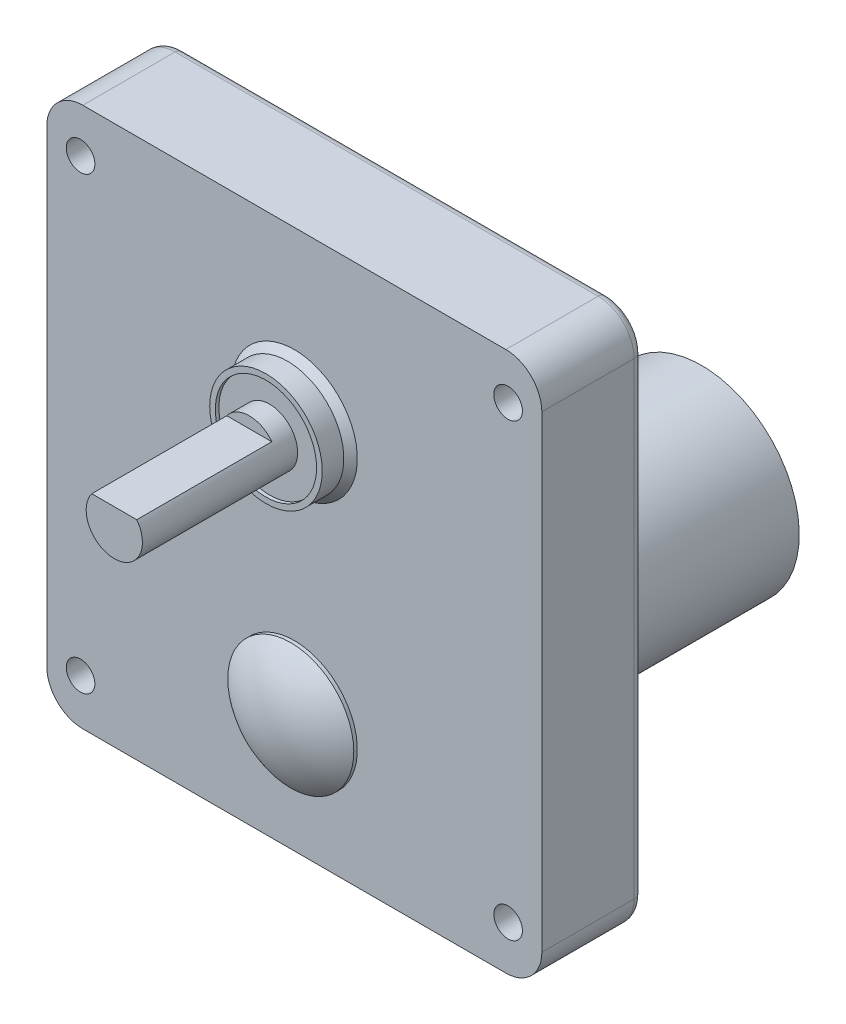
from build123d import *

# Parameters (mm, degrees)
CROQUIS1_W              = 69.85
CROQUIS1_H              = 76.2
EXTRUIR1_DEPTH          = 14.2875
CROQUIS2_R              = 7.9375
CROQUIS2_R_2            = 7.14375
EXTRUIR2_DEPTH          = 4
CROQUIS3_R              = 7.14375
CROQUIS3_R_2            = 3.96875
EXTRUIR3_DEPTH          = 3.5
CROQUIS4_R              = 3.96875
EXTRUIR4_DEPTH          = 25.4
CROQUIS5_W              = 19.05
CROQUIS5_H              = 1.5875
EXTRUIR5_DEPTH          = 3.96875
TALADRO_ROSCADO_10_32_D = 4.0386
CROQUIS7_R              = 8.89
EXTRUIR6_DEPTH          = 0.5
REDONDEO1_R             = 5.08
EXTRUIR7_START          = 3
CROQUIS8_R              = 10
CROQUIS8_R_2            = 7.14375
EXTRUIR7_DEPTH          = 3
EXTRUIR8_START          = 2.5
CROQUIS9_R              = 7.14375
CROQUIS9_R_2            = 3.96875
EXTRUIR8_DEPTH          = 2.5
EXTRUIR9_START          = 3
CROQUIS10_R             = 3.96875
EXTRUIR9_DEPTH          = 3
ENVOLVER1_DEPTH         = 0.5
REDONDEO3_R             = 1.27
CROQUIS15_R             = 7.9375
EXTRUIR13_DEPTH         = 3.175
EXTRUIR14_DEPTH         = 4
FILLET1_R               = 0.762
CHAMFER1_SIZE           = 0.9525


with BuildPart() as part:
    # Croquis1 → Extruir1 (new body)
    with BuildSketch(Plane.XY):
        Rectangle(CROQUIS1_W, CROQUIS1_H)
    extrude(amount=EXTRUIR1_DEPTH)

    # Croquis2 → Extruir2 (add)
    with BuildSketch(Plane.XY.offset(14.2875)):
        with Locations(Location((0, 14.2875, 0), (0, 0, 180))):
            Circle(CROQUIS2_R)
        with Locations((0, 14.2875)):
            Circle(CROQUIS2_R_2, mode=Mode.SUBTRACT)
    extrude(amount=EXTRUIR2_DEPTH)

    # Croquis3 → Extruir3 (add)
    with BuildSketch(Plane.XY.offset(14.2875)):
        with Locations((0, 14.2875)):
            Circle(CROQUIS3_R)
        with Locations((0, 14.2875)):
            Circle(CROQUIS3_R_2, mode=Mode.SUBTRACT)
    extrude(amount=EXTRUIR3_DEPTH)

    # Croquis4 → Extruir4 (add)
    with BuildSketch(Plane.XY.offset(14.2875)):
        with Locations((0, 14.2875)):
            Circle(CROQUIS4_R)
    extrude(amount=EXTRUIR4_DEPTH)

    # Croquis5 → Extruir5 (cut, symmetric)
    with BuildSketch(Plane(origin=(0, 0, 0), x_dir=(0, 0, -1), z_dir=(1, 0, 0))):
        with Locations((-30.1625, 17.4625)):
            Rectangle(CROQUIS5_W, CROQUIS5_H)
    extrude(amount=EXTRUIR5_DEPTH, both=True, mode=Mode.SUBTRACT)

    # Taladro roscado #10-32 (through all)
    with Locations(Plane(origin=(30.1625, 31.75, 14.2875), x_dir=(1, 0, 0), z_dir=(0, 0, 1))):
        with Locations((0, 0), (-60.325, 0), (-60.325, -63.5), (0, -63.5)):
            Hole(TALADRO_ROSCADO_10_32_D / 2)

    # Croquis7 → Extruir6 (add)
    with BuildSketch(Plane.XY.offset(14.2875)):
        with Locations(Location((0, -21.2725, 0), (0, 0, 180))):
            Circle(CROQUIS7_R)
    extrude(amount=EXTRUIR6_DEPTH)

    # Cúpula1: read off the stored shape, not the designer's step
    # Cúpula1 outline → Cúpula1 (revolve)
    with BuildSketch(Plane.XZ.offset(21.2725)):
        with BuildLine():
            Line((0, 14.7875), (8.890000011, 14.787499991))
            ThreePointArc((8.890000011, 14.787499991), (4.719976834, 17.144935114), (0, 17.9625))
            Line((0, 17.9625), (0, 14.7875))
        make_face()
    revolve(axis=Axis((0, -21.2725, 0), (0, 0, 1)))

    # Redondeo1
    redondeo1_edges = [part.edges().sort_by_distance(p)[0] for p in [
        (-34.925, 38.1, 7.14375),
        (34.925, 38.1, 7.14375),
        (34.925, -38.1, 7.14375),
        (-34.925, -38.1, 7.14375),
    ]]
    fillet(redondeo1_edges, radius=REDONDEO1_R)

    # Croquis8 → Extruir7 (add)
    with BuildSketch(Plane(origin=(0, 0, 0), x_dir=(-1, 0, 0), z_dir=(0, 0, -1)).offset(EXTRUIR7_START)):
        with Locations((0, 14.2875)):
            Circle(CROQUIS8_R)
        with Locations(Location((0, 14.2875, 0), (0, 0, 180))):
            Circle(CROQUIS8_R_2, mode=Mode.SUBTRACT)
    extrude(amount=-EXTRUIR7_DEPTH)

    # Croquis9 → Extruir8 (add)
    with BuildSketch(Plane(origin=(0, 0, 0), x_dir=(-1, 0, 0), z_dir=(0, 0, -1)).offset(EXTRUIR8_START)):
        with Locations(Location((0, 14.2875, 0), (0, 0, 180))):
            Circle(CROQUIS9_R)
        with Locations(Location((0, 14.2875, 0), (0, 0, 36.869897646))):
            Circle(CROQUIS9_R_2, mode=Mode.SUBTRACT)
    extrude(amount=-EXTRUIR8_DEPTH)

    # Croquis10 → Extruir9 (add)
    with BuildSketch(Plane(origin=(0, 0, 0), x_dir=(-1, 0, 0), z_dir=(0, 0, -1)).offset(EXTRUIR9_START)):
        with Locations(Location((0, 14.2875, 0), (0, 0, 36.869897646))):
            Circle(CROQUIS10_R)
    extrude(amount=-EXTRUIR9_DEPTH)

    # Envolver1: read off the stored shape, not the designer's step
    # Envolver1 outline → Envolver1 (add)
    with BuildSketch(Plane(origin=(0, 0, 0), x_dir=(-1, 0, 0), z_dir=(0, 0, -1))):
        Polygon((-7.459471243, 34.190889413), (-7.513744748, 34.190889413), (-8.072592237, 29.957556079), (-7.690133636, 29.957556079), (-7.285626425, 33.010440695), (-5.751551906, 29.957556079), (-5.665901532, 29.957556079), (-4.137763177, 33.003656507), (-3.732407942, 29.957556079), (-3.350797365, 29.957556079), (-3.913036948, 34.190889413), (-3.968158476, 34.190889413), (-5.711694801, 30.717385139), align=None)
        Polygon((0.204117165, 34.190889413), (-0.337769854, 34.190889413), (-2.102506767, 32.578796731), (-2.102506767, 34.190889413), (-2.482421297, 34.190889413), (-2.482421297, 29.957556079), (-2.102506767, 29.957556079), (-2.102506767, 32.000444701), (-0.139332354, 29.957556079), (0.366937678, 29.957556079), (-1.876084491, 32.291316763), align=None)
        Polygon((5.929971866, 34.190889413), (5.522920584, 34.190889413), (4.111809472, 30.854764947), (2.700698361, 34.190889413), (2.293647079, 34.190889413), (4.08467272, 29.957556079), (4.138946225, 29.957556079), align=None)
        Polygon((8.752194088, 34.190889413), (6.689800925, 34.190889413), (6.689800925, 29.957556079), (7.069715455, 29.957556079), (7.069715455, 32.019949242), (8.752194088, 32.019949242), (8.752194088, 32.454137276), (7.069715455, 32.454137276), (7.069715455, 33.756701379), (8.752194088, 33.756701379), align=None)
    extrude(amount=ENVOLVER1_DEPTH)

    # Redondeo3
    redondeo3_edges = [part.edges().sort_by_distance(p)[0] for p in [
        (0, -38.1, 0),
        (-34.925, 0, 0),
        (0, 38.1, 0),
        (34.925, 0, 0),
        (-33.437102448, 36.612102448, 0),
        (33.437102448, 36.612102448, 0),
        (33.437102448, -36.612102448, 0),
        (-33.437102448, -36.612102448, 0),
    ]]
    fillet(redondeo3_edges, radius=REDONDEO3_R)

    # Croquis15 → Extruir13 (add)
    with BuildSketch(Plane(origin=(0, 0, 0), x_dir=(-1, 0, 0), z_dir=(0, 0, -1))):
        with Locations((0, -21.2725)):
            Circle(CROQUIS15_R)
    extrude(amount=EXTRUIR13_DEPTH)

    # Croquis16 → Extruir14 (add)
    with BuildSketch(Plane(origin=(0, 0, 0), x_dir=(-1, 0, 0), z_dir=(0, 0, -1))):
        with BuildLine():
            Line((-0.783175899, -29.17126837), (-1, -30.74486111))
            ThreePointArc((-1, -30.74486111), (0, -30.7975), (1, -30.74486111))
            Line((1, -30.74486111), (0.783175899, -29.17126837))
            ThreePointArc((0.783175899, -29.17126837), (0, -29.21), (-0.783175899, -29.17126837))
        make_face()
    extrude(amount=EXTRUIR14_DEPTH)

    # Recubrir1: read off the stored shape, not the designer's step
    # Recubrir1: loft between two sections, ruled curve by curve
    recubrir1_from = [
        Edge.make_bspline([(-1.31936525, -16.449712908, -3.175), (8.326208935, -13.810982408, -3.175), (10.964939434, -23.456556593, -3.175), (1.31936525, -26.095287092, -3.175), (-8.326208935, -28.734017592, -3.175), (-10.964939434, -19.088443407, -3.175), (-1.31936525, -16.449712908, -3.175)], [0, 0, 0, 0, 0.5, 0.5, 0.5, 1, 1, 1, 1], 3, [1, 0.333333333, 0.333333333, 1, 0.333333333, 0.333333333, 1]),
    ]
    recubrir1_to = [
        Edge.make_bspline([(-2.957878031, -20.118557821, -4.675), (-0.649993674, -14.202801759, -4.675), (5.265762389, -16.510686116, -4.675), (2.957878031, -22.426442179, -4.675), (0.649993674, -28.342198241, -4.675), (-5.265762389, -26.034313884, -4.675), (-2.957878031, -20.118557821, -4.675)], [0, 0, 0, 0, 0.5, 0.5, 0.5, 1, 1, 1, 1], 3, [1, 0.333333333, 0.333333333, 1, 0.333333333, 0.333333333, 1]),
    ]
    recubrir1 = Solid(Shell([*[Face.make_surface_from_curves(recubrir1_from[k], recubrir1_to[k]) for k in range(1)], Face(Wire(recubrir1_from)), Face(Wire(recubrir1_to))]))
    add(recubrir1)

    # Sketch2 → Revolve1 (revolve)
    with BuildSketch(Plane(origin=(0, 0, 0), x_dir=(0, 0, -1), z_dir=(1, 0, 0)), mode=Mode.PRIVATE) as revolve1_sk:
        Polygon((3.175, -21.2725), (47.3964, -21.2725), (47.3964, -20.1295), (45.974, -20.1295), (45.974, -16.8275), (47.244, -16.8275), (47.244, -16.3195), (43.688, -16.3195), (43.688, -11.684), (42.164, -11.684), (42.164, -7.874), (43.18, -7.874), (43.18, -7.493), (3.175, -7.493), align=None)
    revolve(revolve1_sk.sketch.rotate(Axis((0, -21.2725, -3.175), (0, 0, -1)), 180), axis=Axis((0, -21.2725, -3.175), (0, 0, -1)))

    # Fillet1
    fillet1_edges = [part.edges().sort_by_distance(p)[0] for p in [
        (0, -11.684, -43.688),
        (0, -20.1295, -47.3964),
    ]]
    fillet(fillet1_edges, radius=FILLET1_R)

    # Chamfer1
    chamfer1_edges = [part.edges().sort_by_distance(p)[0] for p in [
        (7.9375, 14.2875, 14.2875),
    ]]
    chamfer(chamfer1_edges, length=CHAMFER1_SIZE)


solid = part.part
